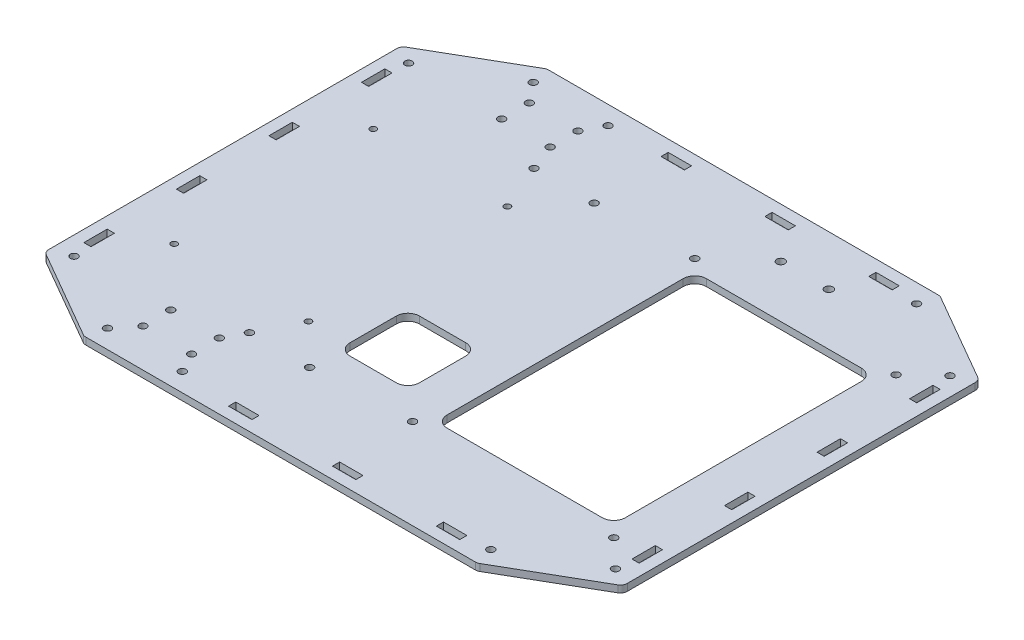
from build123d import *

# Parameters (mm, degrees)
SKETCH1_R           = 1.6
SKETCH1_R_2         = 1.59
SKETCH1_R_3         = 1.75
SKETCH1_W           = 10.1
SKETCH1_H           = 3.1
SKETCH1_W_2         = 3.1
SKETCH1_H_2         = 10.1
BOSS_EXTRUDE1_DEPTH = 3
CUT_EXTRUDE1_REACH  = 162.106
SKETCH3_R           = 1.35
SKETCH3_R_2         = 1.6
FILLET1_R           = 3


with BuildPart() as part:
    # Sketch1 → Boss-Extrude1 (new body)
    with BuildSketch(Plane(origin=(0, 0, 0), x_dir=(1, 0, 0), z_dir=(0, 1, 0))):
        Polygon((-85, 100), (85, 100), (125, 76.905989232), (125, -76.905989232), (85, -100), (-85, -100), (-125, -76.905989232), (-125, 76.905989232), align=None)
        with Locations((-50.5, -63)):
            Circle(SKETCH1_R, mode=Mode.SUBTRACT)
        with Locations((82.856406461, 92)):
            Circle(SKETCH1_R, mode=Mode.SUBTRACT)
        with Locations((117, 72.287187079)):
            Circle(SKETCH1_R, mode=Mode.SUBTRACT)
        with Locations((117, -72.287187079)):
            Circle(SKETCH1_R, mode=Mode.SUBTRACT)
        with Locations((82.856406461, -92)):
            Circle(SKETCH1_R, mode=Mode.SUBTRACT)
        with Locations((-24.5, -63)):
            Circle(SKETCH1_R, mode=Mode.SUBTRACT)
        with Locations((-24.5, 60)):
            Circle(SKETCH1_R, mode=Mode.SUBTRACT)
        with Locations((-117, -72.287187079)):
            Circle(SKETCH1_R, mode=Mode.SUBTRACT)
        with Locations((-50.5, -92)):
            Circle(SKETCH1_R, mode=Mode.SUBTRACT)
        with Locations((-50.5, 60)):
            Circle(SKETCH1_R, mode=Mode.SUBTRACT)
        with Locations((-117, 72.287187079)):
            Circle(SKETCH1_R, mode=Mode.SUBTRACT)
        with Locations((-50.5, 92)):
            Circle(SKETCH1_R, mode=Mode.SUBTRACT)
        with Locations((-82.856406461, -92)):
            Circle(SKETCH1_R, mode=Mode.SUBTRACT)
        with Locations((-82.856406461, 92)):
            Circle(SKETCH1_R, mode=Mode.SUBTRACT)
        with Locations((-55, 71.5)):
            Circle(SKETCH1_R_2, mode=Mode.SUBTRACT)
        with Locations((-76, 71.5)):
            Circle(SKETCH1_R_2, mode=Mode.SUBTRACT)
        with Locations((-55, 83.5)):
            Circle(SKETCH1_R_2, mode=Mode.SUBTRACT)
        with Locations((-76, 83.5)):
            Circle(SKETCH1_R_2, mode=Mode.SUBTRACT)
        with Locations((-55, -83.5)):
            Circle(SKETCH1_R_2, mode=Mode.SUBTRACT)
        with Locations((-55, -71.5)):
            Circle(SKETCH1_R_2, mode=Mode.SUBTRACT)
        with Locations((-76, -71.5)):
            Circle(SKETCH1_R_2, mode=Mode.SUBTRACT)
        with Locations((-76, -83.5)):
            Circle(SKETCH1_R_2, mode=Mode.SUBTRACT)
        with Locations((37.707416379, 78.475)):
            Circle(SKETCH1_R_3, mode=Mode.SUBTRACT)
        with Locations((58.457416379, 78.475)):
            Circle(SKETCH1_R_3, mode=Mode.SUBTRACT)
        with Locations((-22.45, -93.45)):
            Rectangle(SKETCH1_W, SKETCH1_H, mode=Mode.SUBTRACT)
        with Locations((-118.45, 60)):
            Rectangle(SKETCH1_W_2, SKETCH1_H_2, mode=Mode.SUBTRACT)
        with Locations((-118.45, 20)):
            Rectangle(SKETCH1_W_2, SKETCH1_H_2, mode=Mode.SUBTRACT)
        with Locations((-118.45, -20)):
            Rectangle(SKETCH1_W_2, SKETCH1_H_2, mode=Mode.SUBTRACT)
        with Locations((-118.45, -60)):
            Rectangle(SKETCH1_W_2, SKETCH1_H_2, mode=Mode.SUBTRACT)
        with Locations((118.45, -60)):
            Rectangle(SKETCH1_W_2, SKETCH1_H_2, mode=Mode.SUBTRACT)
        with Locations((118.45, -20)):
            Rectangle(SKETCH1_W_2, SKETCH1_H_2, mode=Mode.SUBTRACT)
        with Locations((118.45, 20)):
            Rectangle(SKETCH1_W_2, SKETCH1_H_2, mode=Mode.SUBTRACT)
        with Locations((118.45, 60)):
            Rectangle(SKETCH1_W_2, SKETCH1_H_2, mode=Mode.SUBTRACT)
        with Locations((22.45, -93.45)):
            Rectangle(SKETCH1_W, SKETCH1_H, mode=Mode.SUBTRACT)
        with Locations((67.35, -93.45)):
            Rectangle(SKETCH1_W, SKETCH1_H, mode=Mode.SUBTRACT)
        with Locations((67.35, 93.45)):
            Rectangle(SKETCH1_W, SKETCH1_H, mode=Mode.SUBTRACT)
        with Locations((22.45, 93.45)):
            Rectangle(SKETCH1_W, SKETCH1_H, mode=Mode.SUBTRACT)
        with Locations((-22.45, 93.45)):
            Rectangle(SKETCH1_W, SKETCH1_H, mode=Mode.SUBTRACT)
    extrude(amount=BOSS_EXTRUDE1_DEPTH)

    # Sketch3 → Cut-Extrude1 (cut, up to next)
    with BuildSketch(Plane(origin=(0, 3, 0), x_dir=(1, 0, 0), z_dir=(0, 1, 0)), mode=Mode.PRIVATE) as cut_extrude1_sk1:
        with Locations((-100, -46)):
            Circle(SKETCH3_R)
    cut_extrude1_tool1 = extrude(cut_extrude1_sk1.sketch, amount=-CUT_EXTRUDE1_REACH, mode=Mode.PRIVATE) & part.part
    # Sketch3 → Cut-Extrude1 (cut, up to next)
    with BuildSketch(Plane(origin=(0, 3, 0), x_dir=(1, 0, 0), z_dir=(0, 1, 0)), mode=Mode.PRIVATE) as cut_extrude1_sk2:
        with Locations((-42, -46)):
            Circle(SKETCH3_R)
    cut_extrude1_tool2 = extrude(cut_extrude1_sk2.sketch, amount=-CUT_EXTRUDE1_REACH, mode=Mode.PRIVATE) & part.part
    # Sketch3 → Cut-Extrude1 (cut, up to next)
    with BuildSketch(Plane(origin=(0, 3, 0), x_dir=(1, 0, 0), z_dir=(0, 1, 0)), mode=Mode.PRIVATE) as cut_extrude1_sk3:
        with Locations((-42, 40)):
            Circle(SKETCH3_R)
    cut_extrude1_tool3 = extrude(cut_extrude1_sk3.sketch, amount=-CUT_EXTRUDE1_REACH, mode=Mode.PRIVATE) & part.part
    # Sketch3 → Cut-Extrude1 (cut, up to next)
    with BuildSketch(Plane(origin=(0, 3, 0), x_dir=(1, 0, 0), z_dir=(0, 1, 0)), mode=Mode.PRIVATE) as cut_extrude1_sk4:
        with Locations((-100, 40)):
            Circle(SKETCH3_R)
    cut_extrude1_tool4 = extrude(cut_extrude1_sk4.sketch, amount=-CUT_EXTRUDE1_REACH, mode=Mode.PRIVATE) & part.part
    # Sketch3 → Cut-Extrude1 (cut, up to next)
    with BuildSketch(Plane(origin=(0, 3, 0), x_dir=(1, 0, 0), z_dir=(0, 1, 0)), mode=Mode.PRIVATE) as cut_extrude1_sk5:
        with Locations((18, 61)):
            Circle(SKETCH3_R_2)
    cut_extrude1_tool5 = extrude(cut_extrude1_sk5.sketch, amount=-CUT_EXTRUDE1_REACH, mode=Mode.PRIVATE) & part.part
    # Sketch3 → Cut-Extrude1 (cut, up to next)
    with BuildSketch(Plane(origin=(0, 3, 0), x_dir=(1, 0, 0), z_dir=(0, 1, 0)), mode=Mode.PRIVATE) as cut_extrude1_sk6:
        with Locations((105, 61)):
            Circle(SKETCH3_R_2)
    cut_extrude1_tool6 = extrude(cut_extrude1_sk6.sketch, amount=-CUT_EXTRUDE1_REACH, mode=Mode.PRIVATE) & part.part
    # Sketch3 → Cut-Extrude1 (cut, up to next)
    with BuildSketch(Plane(origin=(0, 3, 0), x_dir=(1, 0, 0), z_dir=(0, 1, 0)), mode=Mode.PRIVATE) as cut_extrude1_sk7:
        with Locations((105, -61)):
            Circle(SKETCH3_R_2)
    cut_extrude1_tool7 = extrude(cut_extrude1_sk7.sketch, amount=-CUT_EXTRUDE1_REACH, mode=Mode.PRIVATE) & part.part
    # Sketch3 → Cut-Extrude1 (cut, up to next)
    with BuildSketch(Plane(origin=(0, 3, 0), x_dir=(1, 0, 0), z_dir=(0, 1, 0)), mode=Mode.PRIVATE) as cut_extrude1_sk8:
        with Locations((18, -61)):
            Circle(SKETCH3_R_2)
    cut_extrude1_tool8 = extrude(cut_extrude1_sk8.sketch, amount=-CUT_EXTRUDE1_REACH, mode=Mode.PRIVATE) & part.part
    # Sketch3 → Cut-Extrude1 (cut, up to next)
    with BuildSketch(Plane(origin=(0, 3, 0), x_dir=(1, 0, 0), z_dir=(0, 1, 0)), mode=Mode.PRIVATE) as cut_extrude1_sk9:
        with BuildLine():
            Line((28, 56), (95, 56))
            ThreePointArc((95, 56), (98.535533906, 54.535533906), (100, 51))
            Line((100, 51), (100, -51))
            ThreePointArc((100, -51), (98.535533906, -54.535533906), (95, -56))
            Line((95, -56), (28, -56))
            ThreePointArc((28, -56), (24.464466094, -54.535533906), (23, -51))
            Line((23, -51), (23, 51))
            ThreePointArc((23, 51), (24.464466094, 54.535533906), (28, 56))
        make_face()
    cut_extrude1_tool9 = extrude(cut_extrude1_sk9.sketch, amount=-CUT_EXTRUDE1_REACH, mode=Mode.PRIVATE) & part.part
    # Sketch3 → Cut-Extrude1 (cut, up to next)
    with BuildSketch(Plane(origin=(0, 3, 0), x_dir=(1, 0, 0), z_dir=(0, 1, 0)), mode=Mode.PRIVATE) as cut_extrude1_sk10:
        with BuildLine():
            Line((-20, -50), (0, -50))
            ThreePointArc((0, -50), (3.535533906, -48.535533906), (5, -45))
            Line((5, -45), (5, -25))
            ThreePointArc((5, -25), (3.535533906, -21.464466094), (0, -20))
            Line((0, -20), (-20, -20))
            ThreePointArc((-20, -20), (-23.535533906, -21.464466094), (-25, -25))
            Line((-25, -25), (-25, -45))
            ThreePointArc((-25, -45), (-23.535533906, -48.535533906), (-20, -50))
        make_face()
    cut_extrude1_tool10 = extrude(cut_extrude1_sk10.sketch, amount=-CUT_EXTRUDE1_REACH, mode=Mode.PRIVATE) & part.part
    add(cut_extrude1_tool1.solids().sort_by_distance((-100, 3, 46))[0], mode=Mode.SUBTRACT)
    add(cut_extrude1_tool2.solids().sort_by_distance((-42, 3, 46))[0], mode=Mode.SUBTRACT)
    add(cut_extrude1_tool3.solids().sort_by_distance((-42, 3, -40))[0], mode=Mode.SUBTRACT)
    add(cut_extrude1_tool4.solids().sort_by_distance((-100, 3, -40))[0], mode=Mode.SUBTRACT)
    add(cut_extrude1_tool5.solids().sort_by_distance((18, 3, -61))[0], mode=Mode.SUBTRACT)
    add(cut_extrude1_tool6.solids().sort_by_distance((105, 3, -61))[0], mode=Mode.SUBTRACT)
    add(cut_extrude1_tool7.solids().sort_by_distance((105, 3, 61))[0], mode=Mode.SUBTRACT)
    add(cut_extrude1_tool8.solids().sort_by_distance((18, 3, 61))[0], mode=Mode.SUBTRACT)
    add(cut_extrude1_tool9.solids().sort_by_distance((61.5, 3, 0))[0], mode=Mode.SUBTRACT)
    add(cut_extrude1_tool10.solids().sort_by_distance((-10, 3, 35))[0], mode=Mode.SUBTRACT)

    # Fillet1
    fillet1_edges = [part.edges().sort_by_distance(p)[0] for p in [
        (85, 1.5, -100),
        (125, 1.5, -76.905989232),
        (-85, 1.5, -100),
        (-125, 1.5, -76.905989232),
        (-85, 1.5, 100),
        (-125, 1.5, 76.905989232),
        (85, 1.5, 100),
        (125, 1.5, 76.905989232),
    ]]
    fillet(fillet1_edges, radius=FILLET1_R)


solid = part.part
